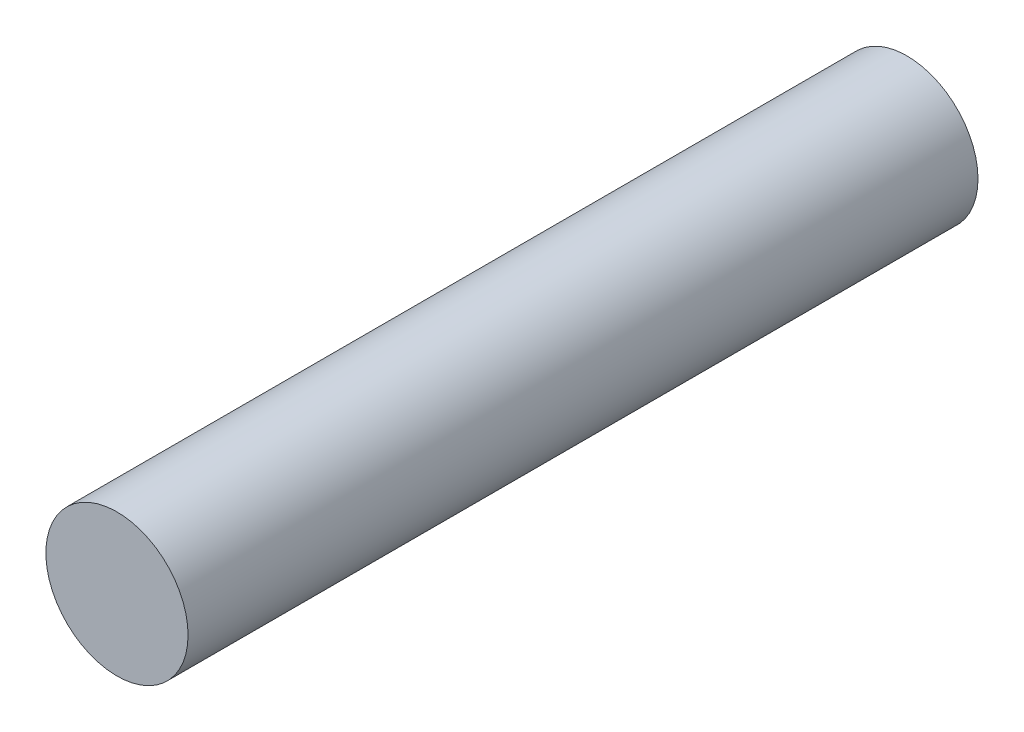
from build123d import *

# Parameters (mm, degrees)
ESQUISSE1_R        = 4.5
BOSS_EXTRU_1_DEPTH = 50


with BuildPart() as part:
    # Esquisse1 → Boss.-Extru.1 (new body)
    with BuildSketch(Plane.XY):
        Circle(ESQUISSE1_R)
    extrude(amount=BOSS_EXTRU_1_DEPTH)


solid = part.part
